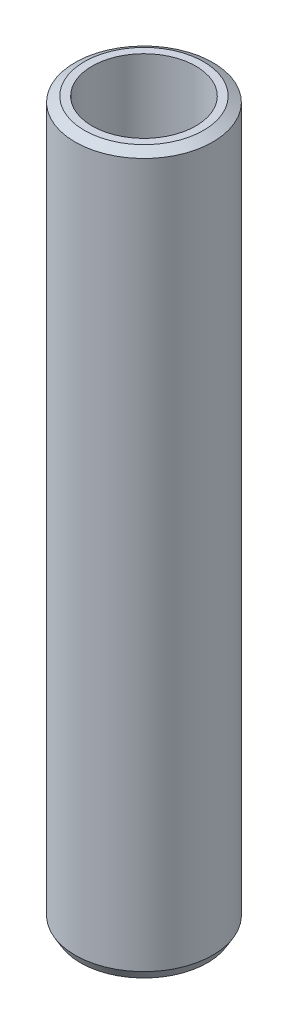
from build123d import *
from OCP.BRepFilletAPI import BRepFilletAPI_MakeChamfer

# Parameters (mm, degrees)
SKETCH1_R           = 57.5
BOSS_EXTRUDE1_DEPTH = 600
SKETCH2_R           = 43.291669187
CUT_EXTRUDE1_DEPTH  = 606.485342515
CHAMFER1_SIZE       = 4.494839011
CHAMFER1_SIZE2      = 7.785289539


with BuildPart() as part:
    # Sketch1 → Boss-Extrude1 (new body)
    with BuildSketch(Plane(origin=(0, 0, 0), x_dir=(1, 0, 0), z_dir=(0, 1, 0))):
        Circle(SKETCH1_R)
    extrude(amount=BOSS_EXTRUDE1_DEPTH)

    # Sketch2 → Cut-Extrude1 (cut, through all)
    with BuildSketch(Plane(origin=(0, 0, 0), x_dir=(1, 0, 0), z_dir=(0, 1, 0))):
        Circle(SKETCH2_R)
    extrude(amount=CUT_EXTRUDE1_DEPTH, mode=Mode.SUBTRACT)

    # Chamfer1: one chamfer whose edges measure the first distance from different faces: ONE call of the kernel's chamfer builder (chamfer() names one face for all edges)
    chamfer1_edges_1 = [part.edges().sort_by_distance(p)[0] for p in [
        (-57.5, 600, 0),
    ]]
    chamfer1_side_1 = [part.faces().sort_by_distance(p)[0] for p in [
        (-57.5, 300, 0),
    ]]
    chamfer1_edges_2 = [part.edges().sort_by_distance(p)[0] for p in [
        (-57.5, 0, 0),
    ]]
    chamfer1_side_2 = [part.faces().sort_by_distance(p)[0] for p in [
        (-55.873654403, 0, 0),
    ]]
    chamfer1 = BRepFilletAPI_MakeChamfer(part.part.solid().wrapped)
    for e in chamfer1_edges_1:
        chamfer1.Add(CHAMFER1_SIZE, CHAMFER1_SIZE2, e.wrapped, chamfer1_side_1[0].wrapped)  # the first distance lies on this face
    for e in chamfer1_edges_2:
        chamfer1.Add(CHAMFER1_SIZE, CHAMFER1_SIZE2, e.wrapped, chamfer1_side_2[0].wrapped)  # the first distance lies on this face
    add(Compound.cast(chamfer1.Shape()), mode=Mode.REPLACE)


solid = part.part
